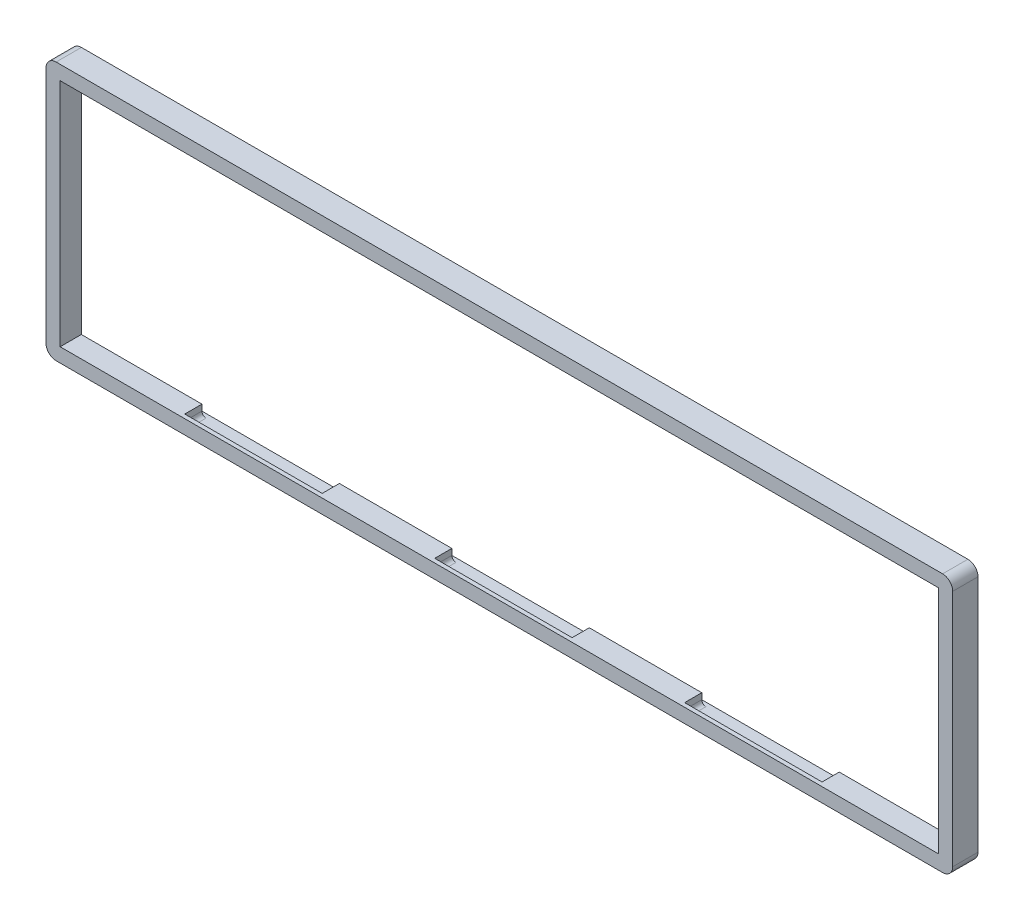
from build123d import *

# Parameters (mm, degrees)
BOSS_EXTRUDE1_DEPTH = 12.5
SKETCH2_W           = 438.581
SKETCH2_H           = 128
SKETCH2_W_2         = 434.581
SKETCH2_H_2         = 114
BOSS_EXTRUDE2_DEPTH = 2
SKETCH3_W           = 440.5822769
SKETCH3_H           = 124
CUT_EXTRUDE1_DEPTH  = 2


with BuildPart() as part:
    # Sketch1 → Boss-Extrude1 (new body)
    with BuildSketch(Plane.XY):
        with BuildLine():
            ThreePointArc((-7, -2), (-5.535533906, -5.535533906), (-2, -7))
            Line((-2, -7), (436.581, -7))
            ThreePointArc((436.581, -7), (440.116533906, -5.535533906), (441.581, -2))
            Line((441.581, -2), (441.581, 116))
            ThreePointArc((441.581, 116), (440.116533906, 119.535533906), (436.581, 121))
            Line((436.581, 121), (-2, 121))
            ThreePointArc((-2, 121), (-5.535533906, 119.535533906), (-7, 116))
            Line((-7, 116), (-7, -2))
        make_face()
        with BuildLine():
            Line((251.291, 114), (306.936, 114))
            Line((306.936, 114), (306.936, 117))
            ThreePointArc((306.936, 117), (307.521786438, 118.414213562), (308.936, 119))
            Line((308.936, 119), (372.936, 119))
            ThreePointArc((372.936, 119), (374.350213562, 118.414213562), (374.936, 117))
            Line((374.936, 117), (374.936, 114))
            Line((374.936, 114), (434.581, 114))
            Line((434.581, 114), (434.581, 0))
            Line((434.581, 0), (374.936, 0))
            Line((374.936, 0), (374.936, -3))
            ThreePointArc((374.936, -3), (374.350213562, -4.414213562), (372.936, -5))
            Line((372.936, -5), (308.936, -5))
            ThreePointArc((308.936, -5), (307.521786438, -4.414213562), (306.936, -3))
            Line((306.936, -3), (306.936, 0))
            Line((306.936, 0), (251.291, 0))
            Line((251.291, 0), (251.291, -3))
            ThreePointArc((251.291, -3), (250.705213562, -4.414213562), (249.291, -5))
            Line((249.291, -5), (185.291, -5))
            ThreePointArc((185.291, -5), (183.876786438, -4.414213562), (183.291, -3))
            Line((183.291, -3), (183.291, 0))
            Line((183.291, 0), (127.646, 0))
            Line((127.646, 0), (127.646, -3))
            ThreePointArc((127.646, -3), (127.060213562, -4.414213562), (125.646, -5))
            Line((125.646, -5), (61.646, -5))
            ThreePointArc((61.646, -5), (60.231786438, -4.414213562), (59.646, -3))
            Line((59.646, -3), (59.646, 0))
            Line((59.646, 0), (0, 0))
            Line((0, 0), (0, 114))
            Line((0, 114), (59.646, 114))
            Line((59.646, 114), (59.646, 117))
            ThreePointArc((59.646, 117), (60.231786438, 118.414213562), (61.646, 119))
            Line((61.646, 119), (125.646, 119))
            ThreePointArc((125.646, 119), (127.060213562, 118.414213562), (127.646, 117))
            Line((127.646, 117), (127.646, 114))
            Line((127.646, 114), (183.291, 114))
            Line((183.291, 114), (183.291, 117))
            ThreePointArc((183.291, 117), (183.876786438, 118.414213562), (185.291, 119))
            Line((185.291, 119), (249.291, 119))
            ThreePointArc((249.291, 119), (250.705213562, 118.414213562), (251.291, 117))
            Line((251.291, 117), (251.291, 114))
        make_face(mode=Mode.SUBTRACT)
    extrude(amount=BOSS_EXTRUDE1_DEPTH)

    # Sketch2 → Boss-Extrude2 (add)
    with BuildSketch(Plane.XY.offset(12.5)):
        with Locations((217.2905, 57)):
            Rectangle(SKETCH2_W, SKETCH2_H)
        with Locations((217.2905, 57)):
            Rectangle(SKETCH2_W_2, SKETCH2_H_2, mode=Mode.SUBTRACT)
    extrude(amount=-BOSS_EXTRUDE2_DEPTH)

    # Sketch3 → Cut-Extrude1 (cut)
    with BuildSketch(Plane(origin=(0, 0, 0), x_dir=(-1, 0, 0), z_dir=(0, 0, -1))):
        with Locations((-217.28986155, 57)):
            Rectangle(SKETCH3_W, SKETCH3_H)
    extrude(amount=-CUT_EXTRUDE1_DEPTH, mode=Mode.SUBTRACT)


solid = part.part
